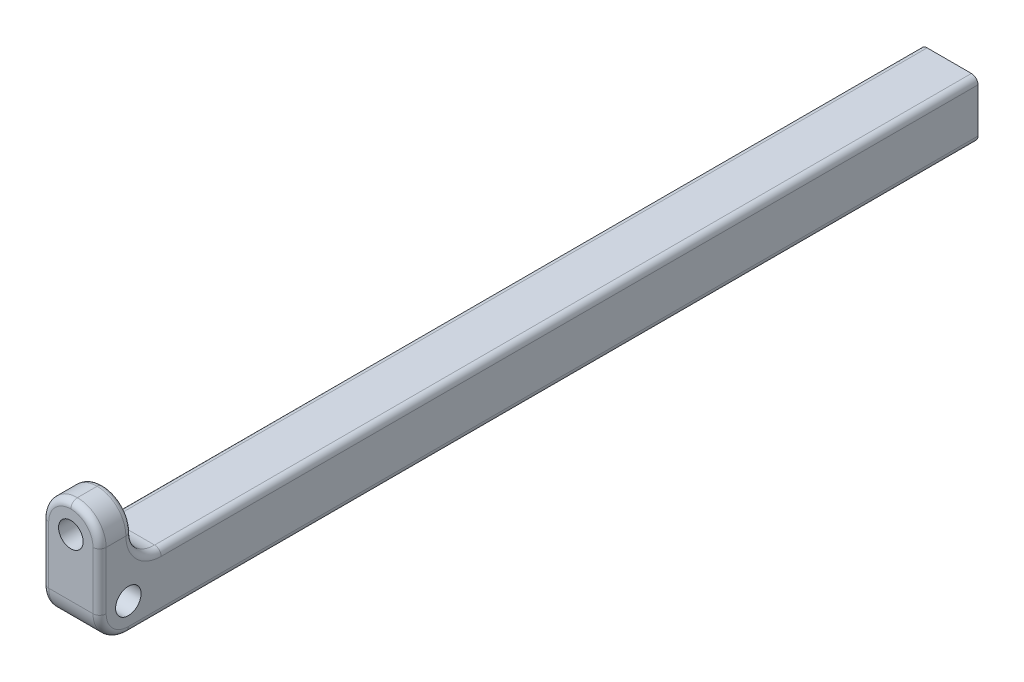
from build123d import *

# Parameters (mm, degrees)
SKETCH_1_W          = 7
SKETCH_1_H          = 7
EXTRUDE_1_DEPTH     = 107
FILLET_1_R          = 3.5
SKETCH_5_R          = 1.55
CUT_EXTRUDE_2_DEPTH = 108.285833175
SKETCH_6_W          = 7
SKETCH_6_H          = 4
EXTRUDE_2_DEPTH     = 7
FILLET_2_R          = 3.5
SKETCH_7_R          = 1.5
CUT_EXTRUDE_3_DEPTH = 104.592953428
FILLET_3_R          = 3.5
FILLET_4_R          = 0.8
FILLET_5_R          = 0.8


# Some blends are built 0.0001 mm under size
with BuildPart() as part:
    # 草图1 → 凸台-拉伸1 (new body)
    with BuildSketch(Plane.XY):
        Rectangle(SKETCH_1_W, SKETCH_1_H)
    extrude(amount=EXTRUDE_1_DEPTH)

    # 圆角1
    fillet_1_edges = [part.edges().sort_by_distance(p)[0] for p in [
        (0, -3.5, 107),
    ]]
    fillet(fillet_1_edges, radius=FILLET_1_R)

    # 草图5 → 切除-拉伸2 (cut, through all)
    with BuildSketch(Plane(origin=(3.5, 0, 0), x_dir=(0, 0, -1), z_dir=(1, 0, 0))):
        with Locations(Location((-103.5, 0, 0), (0, 0, 90))):
            Circle(SKETCH_5_R)
    extrude(amount=-CUT_EXTRUDE_2_DEPTH, mode=Mode.SUBTRACT)

    # 草图6 → 凸台-拉伸2 (add)
    with BuildSketch(Plane(origin=(0, 3.5, 0), x_dir=(1, 0, 0), z_dir=(0, 1, 0))):
        with Locations((0, -105)):
            Rectangle(SKETCH_6_W, SKETCH_6_H)
    extrude(amount=EXTRUDE_2_DEPTH)

    # 圆角2
    fillet_2_edges = [part.edges().sort_by_distance(p)[0] for p in [
        (3.5, 10.5, 105),
        (-3.5, 10.5, 105),
    ]]
    fillet(fillet_2_edges, radius=FILLET_2_R - 0.0001)  # a hair under: the kernel refuses the full size

    # 草图7 → 切除-拉伸3 (cut, through all)
    with BuildSketch(Plane(origin=(0, 0, 103), x_dir=(-1, 0, 0), z_dir=(0, 0, -1))):
        with Locations((0, 7)):
            Circle(SKETCH_7_R)
    extrude(amount=-CUT_EXTRUDE_3_DEPTH, mode=Mode.SUBTRACT)

    # 圆角3
    # the kernel refuses this fillet: 3.5 mm, written as the material it adds along each edge
    with BuildSketch(Plane(origin=(-3.5, 3.5, 103), x_dir=(0, 1, 0), z_dir=(1, 0, 0))) as fillet_3_piece_1_section:
        with BuildLine():
            CenterArc((FILLET_3_R, -FILLET_3_R), FILLET_3_R, 90, 90)
            Line((0, -FILLET_3_R), (0, 0))
            Line((0, 0), (FILLET_3_R, 0))
        make_face()
    fillet_3_piece_1 = extrude(amount=7, mode=Mode.PRIVATE)
    fillet_3_piece_1 = fillet_3_piece_1 - Plane(origin=(0, 7, 102.188347769), x_dir=(-1, 0, 0), z_dir=(0, 0, -1)) * Cylinder(1.5, 28, mode=Mode.PRIVATE)
    add(fillet_3_piece_1)

    # 圆角4
    fillet_4_edges = [part.edges().sort_by_distance(p)[0] for p in [
        (-2.474903023, 9.474903023, 103),
        (2.474903023, 9.474903023, 103),
        (3.5, 3.5, 49.75),
        (-3.5, 3.5, 49.75),
        (-3.5, 4.525126266, 101.974873734),
        (3.5, 4.525126266, 101.974873734),
    ]]
    fillet(fillet_4_edges, radius=FILLET_4_R)

    # 圆角5
    fillet_5_edges = [part.edges().sort_by_distance(p)[0] for p in [
        (3.5, 3.50005, 107),
        (3.5, -3.5, 51.75),
        (3.5, -2.474873734, 105.974873734),
        (-3.5, -3.5, 51.75),
        (-3.5, -2.474873734, 105.974873734),
        (-3.5, 3.50005, 107),
        (-2.474903023, 9.474903023, 107),
        (2.474903023, 9.474903023, 107),
    ]]
    fillet(fillet_5_edges, radius=FILLET_5_R)


solid = part.part
